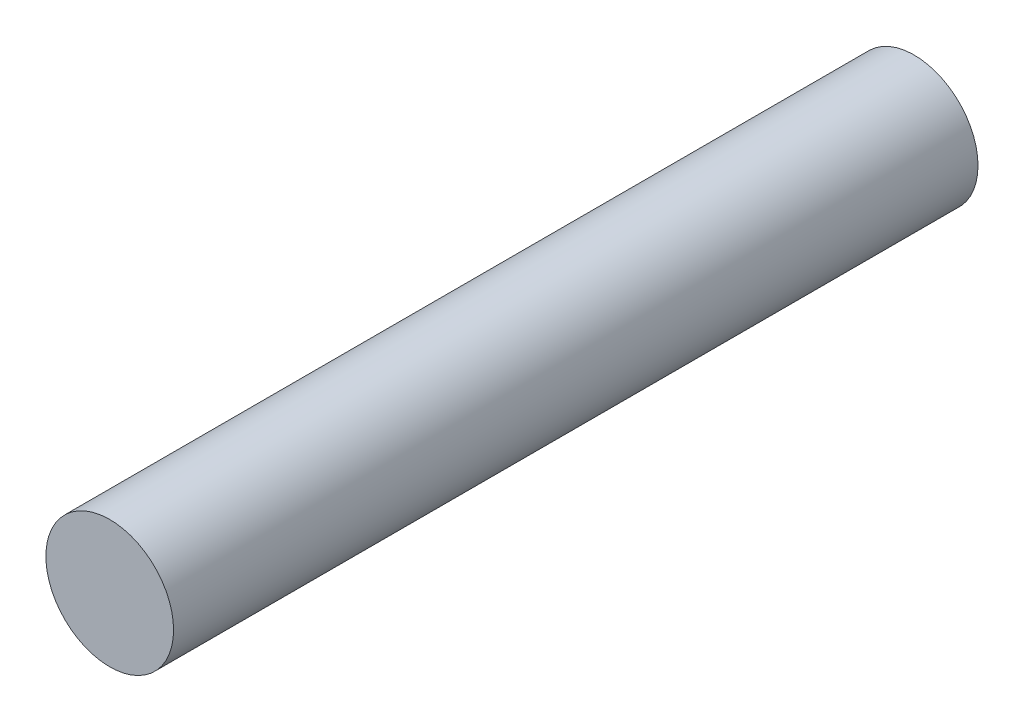
from build123d import *

# Parameters (mm, degrees)
SCHIZZO1_R                   = 50
ESTRUSIONE_ESTRUSIONE1_DEPTH = 630


with BuildPart() as part:
    # Schizzo1 → Estrusione-Estrusione1 (new body)
    with BuildSketch(Plane.XY):
        Circle(SCHIZZO1_R)
    extrude(amount=ESTRUSIONE_ESTRUSIONE1_DEPTH)


solid = part.part
